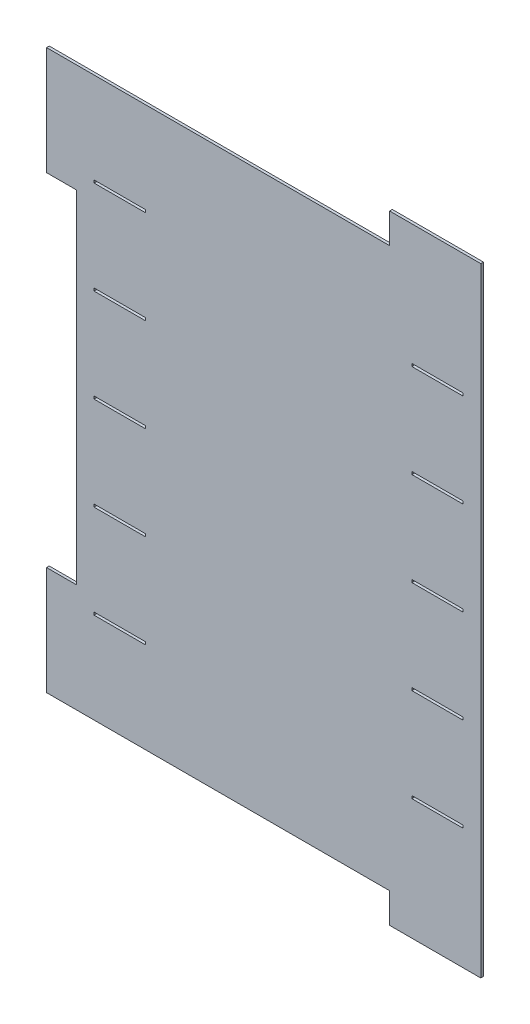
from build123d import *

# Parameters (mm, degrees)
SKETCH1_W               = 475.54896
SKETCH1_H               = 657.23516
BASE_FLANGE1_DEPTH      = 3.175
CUT_EXTRUDE1_DEPTH      = 406.63074076
CUT_EXTRUDE1_DEPTH_BACK = 406.63074076
SKETCH2_W               = 60.325
SKETCH2_H               = 3.175
SKETCH3_W               = 107.287119944
SKETCH3_H               = 35.306
SKETCH3_W_2             = 35.306
SKETCH3_H_2             = 127.472499944
BOSS_EXTRUDE1_DEPTH     = 3.175


# Sheet-metal steps are written as plain solids
with BuildPart() as part:
    # Sketch1 → Base-Flange1 (new body)
    with BuildSketch(Plane.XY):
        Rectangle(SKETCH1_W, SKETCH1_H)
    extrude(amount=-BASE_FLANGE1_DEPTH)

    # Sketch2 → Cut-Extrude1 (cut, two sides: drawn at the far end of the back side and taken through both)
    with BuildSketch(Plane.XY.offset(-CUT_EXTRUDE1_DEPTH_BACK)):
        with Locations((-186.97448, 220.13672)):
            Rectangle(SKETCH2_W, SKETCH2_H)
        with Locations((186.97448, -220.13672)):
            Rectangle(SKETCH2_W, SKETCH2_H)
        with Locations((186.97448, 220.13672)):
            Rectangle(SKETCH2_W, SKETCH2_H)
        with Locations((-186.97448, -220.13672)):
            Rectangle(SKETCH2_W, SKETCH2_H)
        with Locations((-186.97448, 0)):
            Rectangle(SKETCH2_W, SKETCH2_H)
        with Locations((186.97448, -110.06836)):
            Rectangle(SKETCH2_W, SKETCH2_H)
        with Locations((-186.97448, -110.06836)):
            Rectangle(SKETCH2_W, SKETCH2_H)
        with Locations((-186.97448, 110.06836)):
            Rectangle(SKETCH2_W, SKETCH2_H)
        with Locations((186.97448, 0)):
            Rectangle(SKETCH2_W, SKETCH2_H)
        with Locations((186.97448, 110.06836)):
            Rectangle(SKETCH2_W, SKETCH2_H)
    extrude(amount=CUT_EXTRUDE1_DEPTH + CUT_EXTRUDE1_DEPTH_BACK, mode=Mode.SUBTRACT)

    # Sketch3 → Boss-Extrude1 (add)
    with BuildSketch(Plane.XY):
        with Locations((184.130920028, 346.27058)):
            Rectangle(SKETCH3_W, SKETCH3_H)
        with Locations((-255.42748, 264.881330028)):
            Rectangle(SKETCH3_W_2, SKETCH3_H_2)
        with Locations((-255.42748, -264.881330028)):
            Rectangle(SKETCH3_W_2, SKETCH3_H_2)
        with Locations((184.130920028, -346.27058)):
            Rectangle(SKETCH3_W, SKETCH3_H)
    extrude(amount=-BOSS_EXTRUDE1_DEPTH)


solid = part.part
